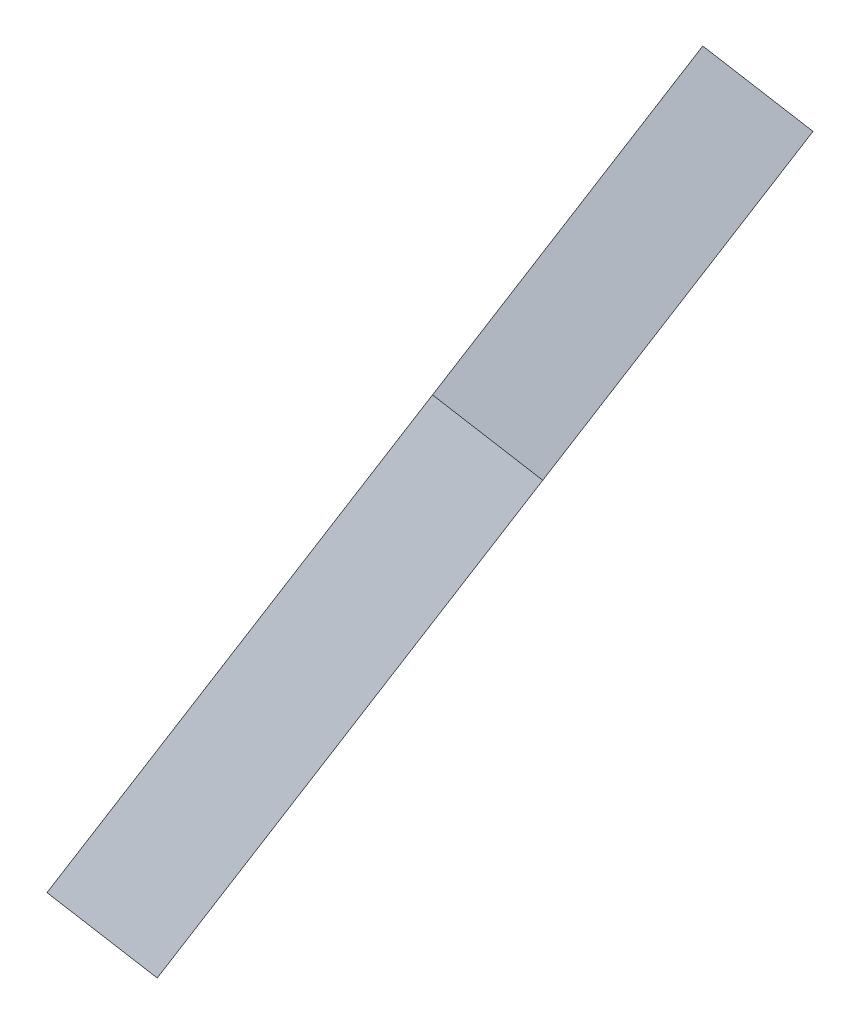
from build123d import *

# Parameters (mm, degrees)
BOSS_EXTRUDE1_DEPTH = 3


with BuildPart() as part:
    # Sketch2 → Boss-Extrude1 (new body)
    with BuildSketch(Plane(origin=(-19.877539657, 12.284995121, 7.592544536), x_dir=(-0.2628655560595797, 0.16245984811645547, -0.9510565162951496), z_dir=(0.8090169943749519, -0.49999999999998535, -0.30901699437495955))):
        Polygon((-40.543437921, 50.167685709), (-37.596697082, 49.604908287), (-38.374436352, 45.532612603), (-41.668992766, 43.015795458), (-43.490178761, 45.399758875), (-51.492059519, 39.286865923), (-60.475384548, 50.668863614), (-52.852283422, 63.003300335), (-38.654450114, 60.058554275), align=None)
    extrude(amount=BOSS_EXTRUDE1_DEPTH)


solid = part.part
